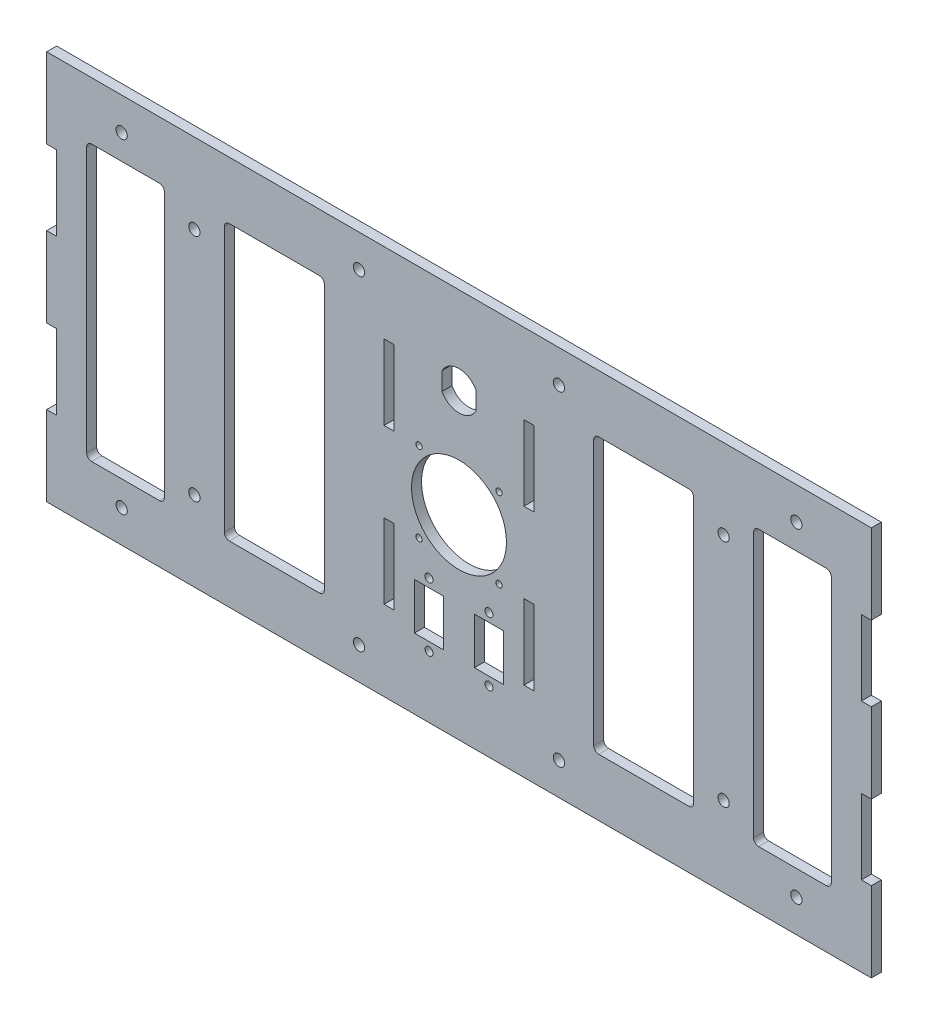
from build123d import *

# Parameters (mm, degrees)
SKIZZE1_W                       = 330
SKIZZE1_H                       = 156
AUFSATZ_LINEAR_AUSTRAGEN1_DEPTH = 4
SKIZZE2_R                       = 2.25
SKIZZE2_W                       = 31.1
SKIZZE2_H                       = 110
SCHNITT_LINEAR_AUSTRAGEN1_DEPTH = 183.551362635
M3_GEWINDEBOHRUNG1_D            = 2.5
SKIZZE5_R                       = 19
SCHNITT_LINEAR_AUSTRAGEN2_DEPTH = 183.551362635
VERRUNDUNG1_R                   = 2
SKIZZE7_R                       = 1.6
SKIZZE7_W                       = 11.7
SKIZZE7_H                       = 18.6
SCHNITT_LINEAR_AUSTRAGEN3_DEPTH = 183.551362635
SCHNITT_LINEAR_AUSTRAGEN4_DEPTH = 183.551362635
VERRUNDUNG2_R                   = 2
SKIZZE10_W                      = 4
SKIZZE10_H                      = 30
SCHNITT_LINEAR_AUSTRAGEN5_DEPTH = 183.551362635


with BuildPart() as part:
    # Skizze1 → Aufsatz-Linear austragen1 (new body)
    with BuildSketch(Plane.XY):
        Rectangle(SKIZZE1_W, SKIZZE1_H)
    extrude(amount=AUFSATZ_LINEAR_AUSTRAGEN1_DEPTH)

    # Skizze2 → Schnitt-Linear austragen1 (cut, through all)
    with BuildSketch(Plane.XY.offset(4)):
        with Locations((-105.9, 46)):
            Circle(SKIZZE2_R)
        with Locations((-105.9, -46)):
            Circle(SKIZZE2_R)
        with Locations((105.9, -46)):
            Circle(SKIZZE2_R)
        with Locations((105.9, 46)):
            Circle(SKIZZE2_R)
        with Locations((-40, 65)):
            Circle(SKIZZE2_R)
        with Locations((40, 65)):
            Circle(SKIZZE2_R)
        with Locations((-40, -65)):
            Circle(SKIZZE2_R)
        with Locations((40, -65)):
            Circle(SKIZZE2_R)
        with Locations((-135, -65)):
            Circle(SKIZZE2_R)
        with Locations((-135, 65)):
            Circle(SKIZZE2_R)
        with Locations((135, -65)):
            Circle(SKIZZE2_R)
        with Locations((135, 65)):
            Circle(SKIZZE2_R)
        with Locations((133.45, 0)):
            Rectangle(SKIZZE2_W, SKIZZE2_H)
        with Locations((-133.45, 0)):
            Rectangle(SKIZZE2_W, SKIZZE2_H)
    extrude(amount=-SCHNITT_LINEAR_AUSTRAGEN1_DEPTH, mode=Mode.SUBTRACT)

    # M3 Gewindebohrung1 (through all)
    with Locations(Plane.XY.offset(4)):
        with Locations((16, -16), (0, 0), (16, 16), (-16, -16), (-16, 16)):
            Hole(M3_GEWINDEBOHRUNG1_D / 2)

    # Skizze5 → Schnitt-Linear austragen2 (cut, through all)
    with BuildSketch(Plane.XY.offset(4)):
        Circle(SKIZZE5_R)
    extrude(amount=-SCHNITT_LINEAR_AUSTRAGEN2_DEPTH, mode=Mode.SUBTRACT)

    # Verrundung1
    verrundung1_edges = [part.edges().sort_by_distance(p)[0] for p in [
        (149, 55, 2),
        (117.9, 55, 2),
        (149, -55, 2),
        (117.9, -55, 2),
        (-149, -55, 2),
        (-117.9, -55, 2),
        (-117.9, 55, 2),
        (-149, 55, 2),
    ]]
    fillet(verrundung1_edges, radius=VERRUNDUNG1_R)

    # Skizze7 → Schnitt-Linear austragen3 (cut, through all)
    with BuildSketch(Plane.XY.offset(4)):
        with Locations((-12, -27.880186595)):
            Circle(SKIZZE7_R)
        with Locations((-12, -53.280186595)):
            Circle(SKIZZE7_R)
        with Locations((12, -53.280186595)):
            Circle(SKIZZE7_R)
        with Locations((12, -27.880186595)):
            Circle(SKIZZE7_R)
        with BuildLine():
            Line((-6.8, 46.612478374), (-6.8, 39.387521626))
            ThreePointArc((-6.8, 39.387521626), (0, 35.3), (6.8, 39.387521626))
            Line((6.8, 39.387521626), (6.8, 46.612478374))
            ThreePointArc((6.8, 46.612478374), (0, 50.7), (-6.8, 46.612478374))
        make_face()
        with Locations((-12, -40.580186595)):
            Rectangle(SKIZZE7_W, SKIZZE7_H)
        with Locations((12, -40.580186595)):
            Rectangle(SKIZZE7_W, SKIZZE7_H)
    extrude(amount=-SCHNITT_LINEAR_AUSTRAGEN3_DEPTH, mode=Mode.SUBTRACT)

    # Skizze9 → Schnitt-Linear austragen4 (cut, through all)
    with BuildSketch(Plane.XY.offset(4)):
        Polygon((53.9, 55), (53.9, 7), (53.9, -7), (53.9, -55), (93.9, -55), (93.9, -7), (93.9, 7), (93.9, 55), align=None)
        Polygon((53.9, 55), (53.9, 7), (53.9, -7), (53.9, -55), (93.9, -55), (93.9, -7), (93.9, 7), (93.9, 55), align=None)
        Polygon((-53.9, 7), (-53.9, -7), (-53.9, -55), (-93.9, -55), (-93.9, -7), (-93.9, 7), (-93.9, 55), (-53.9, 55), align=None)
    extrude(amount=-SCHNITT_LINEAR_AUSTRAGEN4_DEPTH, mode=Mode.SUBTRACT)

    # Verrundung2
    verrundung2_edges = [part.edges().sort_by_distance(p)[0] for p in [
        (-93.9, -55, 2),
        (-53.9, -55, 2),
        (-53.9, 55, 2),
        (-93.9, 55, 2),
        (53.9, -55, 2),
        (93.9, -55, 2),
        (93.9, 55, 2),
        (53.9, 55, 2),
    ]]
    fillet(verrundung2_edges, radius=VERRUNDUNG2_R)

    # Skizze10 → Schnitt-Linear austragen5 (cut, through all)
    with BuildSketch(Plane.XY.offset(4)):
        with Locations((-28, 31)):
            Rectangle(SKIZZE10_W, SKIZZE10_H)
        with Locations((-28, -31)):
            Rectangle(SKIZZE10_W, SKIZZE10_H)
        with Locations((28, -31)):
            Rectangle(SKIZZE10_W, SKIZZE10_H)
        with Locations((28, 31)):
            Rectangle(SKIZZE10_W, SKIZZE10_H)
        with Locations((-163, -31)):
            Rectangle(SKIZZE10_W, SKIZZE10_H)
        with Locations((-163, 31)):
            Rectangle(SKIZZE10_W, SKIZZE10_H)
        with Locations((163, -31)):
            Rectangle(SKIZZE10_W, SKIZZE10_H)
        with Locations((163, 31)):
            Rectangle(SKIZZE10_W, SKIZZE10_H)
    extrude(amount=-SCHNITT_LINEAR_AUSTRAGEN5_DEPTH, mode=Mode.SUBTRACT)


solid = part.part
